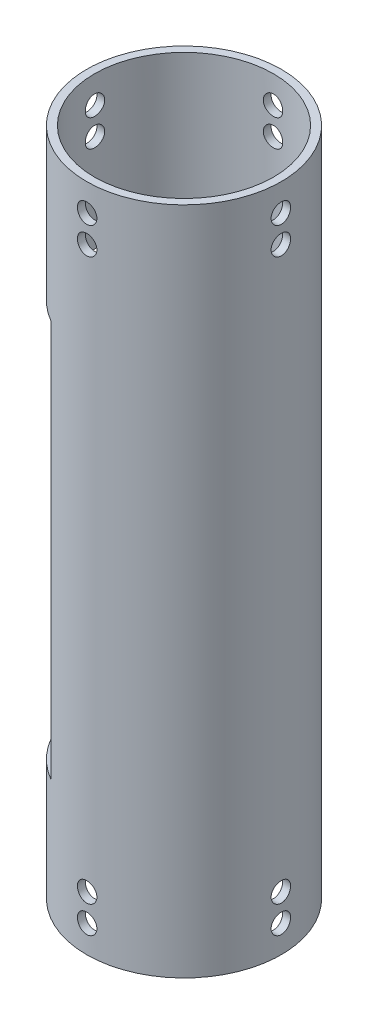
from build123d import *

# Parameters (mm, degrees)
SKETCH_1_R               = 25
SKETCH_1_R_2             = 23
EXTRUDE_1_DEPTH          = 172
CUT_EXTRUDE_1_DEPTH      = 102
SKETCH_3_R               = 2.5
CUT_EXTRUDE_2_DEPTH      = 176.59612752
PATTERN_CIRCULAR_1_COUNT = 4


with BuildPart() as part:
    # Эскиз1 → Бобышка-Вытянуть1 (new body)
    with BuildSketch(Plane(origin=(0, 0, 0), x_dir=(1, 0, 0), z_dir=(0, 1, 0))):
        Circle(SKETCH_1_R)
        Circle(SKETCH_1_R_2, mode=Mode.SUBTRACT)
    extrude(amount=EXTRUDE_1_DEPTH)

    # Эскиз2 → Вырез-Вытянуть1 (cut)
    with BuildSketch(Plane(origin=(0, 31, 0), x_dir=(-1, 0, 0), z_dir=(0, -1, 0))):
        Polygon((0, 0), (29.61457633, 51.293950849), (33.452789958, -57.941931861), align=None)
    extrude(amount=-CUT_EXTRUDE_1_DEPTH, mode=Mode.SUBTRACT)

    # Эскиз3 → Вырез-Вытянуть2 (cut, through all)
    with BuildSketch(Plane(origin=(0, 0, 0), x_dir=(0, 0, -1), z_dir=(1, 0, 0))):
        with Locations((0, 165)):
            Circle(SKETCH_3_R)
        with Locations((0, 158)):
            Circle(SKETCH_3_R)
        with Locations((0, 7)):
            Circle(SKETCH_3_R)
        with Locations((0, 14)):
            Circle(SKETCH_3_R)
    cut_extrude_2 = extrude(amount=-CUT_EXTRUDE_2_DEPTH, mode=Mode.SUBTRACT)

    # Круговой массив1: Вырез-Вытянуть2 ×4 about axis
    pattern_circular_1_axis = Axis((0, 172, 0), (0, -1, 0))
    for i in range(1, PATTERN_CIRCULAR_1_COUNT):
        add(cut_extrude_2.rotate(pattern_circular_1_axis, i * 360 / PATTERN_CIRCULAR_1_COUNT), mode=Mode.SUBTRACT)


solid = part.part
